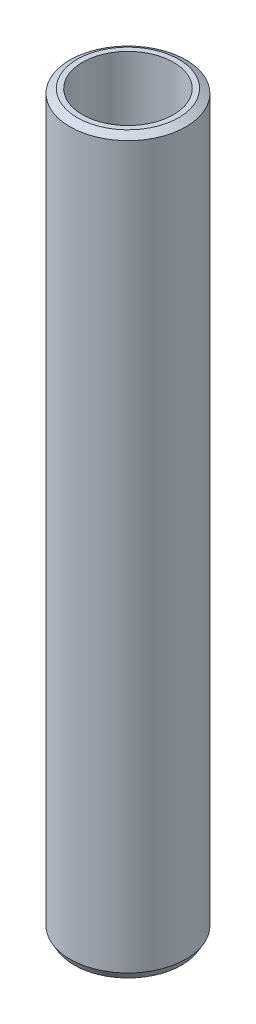
from build123d import *
from OCP.BRepFilletAPI import BRepFilletAPI_MakeChamfer

# Parameters (mm, degrees)
SKETCH1_R           = 47.5
BOSS_EXTRUDE1_DEPTH = 600
SKETCH2_R           = 37.260172546
CUT_EXTRUDE1_DEPTH  = 604.748706003
CHAMFER1_SIZE       = 3.455369206
CHAMFER1_SIZE2      = 5.984875024


with BuildPart() as part:
    # Sketch1 → Boss-Extrude1 (new body)
    with BuildSketch(Plane(origin=(0, 0, 0), x_dir=(1, 0, 0), z_dir=(0, 1, 0))):
        Circle(SKETCH1_R)
    extrude(amount=BOSS_EXTRUDE1_DEPTH)

    # Sketch2 → Cut-Extrude1 (cut, through all)
    with BuildSketch(Plane(origin=(0, 0, 0), x_dir=(1, 0, 0), z_dir=(0, 1, 0))):
        Circle(SKETCH2_R)
    extrude(amount=CUT_EXTRUDE1_DEPTH, mode=Mode.SUBTRACT)

    # Chamfer1: one chamfer whose edges measure the first distance from different faces: ONE call of the kernel's chamfer builder (chamfer() names one face for all edges)
    chamfer1_edges_1 = [part.edges().sort_by_distance(p)[0] for p in [
        (-47.5, 600, 0),
    ]]
    chamfer1_side_1 = [part.faces().sort_by_distance(p)[0] for p in [
        (-47.5, 300, 0),
    ]]
    chamfer1_edges_2 = [part.edges().sort_by_distance(p)[0] for p in [
        (-47.5, 0, 0),
    ]]
    chamfer1_side_2 = [part.faces().sort_by_distance(p)[0] for p in [
        (-46.156497116, 0, 0),
    ]]
    chamfer1 = BRepFilletAPI_MakeChamfer(part.part.solid().wrapped)
    for e in chamfer1_edges_1:
        chamfer1.Add(CHAMFER1_SIZE, CHAMFER1_SIZE2, e.wrapped, chamfer1_side_1[0].wrapped)  # the first distance lies on this face
    for e in chamfer1_edges_2:
        chamfer1.Add(CHAMFER1_SIZE, CHAMFER1_SIZE2, e.wrapped, chamfer1_side_2[0].wrapped)  # the first distance lies on this face
    add(Compound.cast(chamfer1.Shape()), mode=Mode.REPLACE)


solid = part.part
